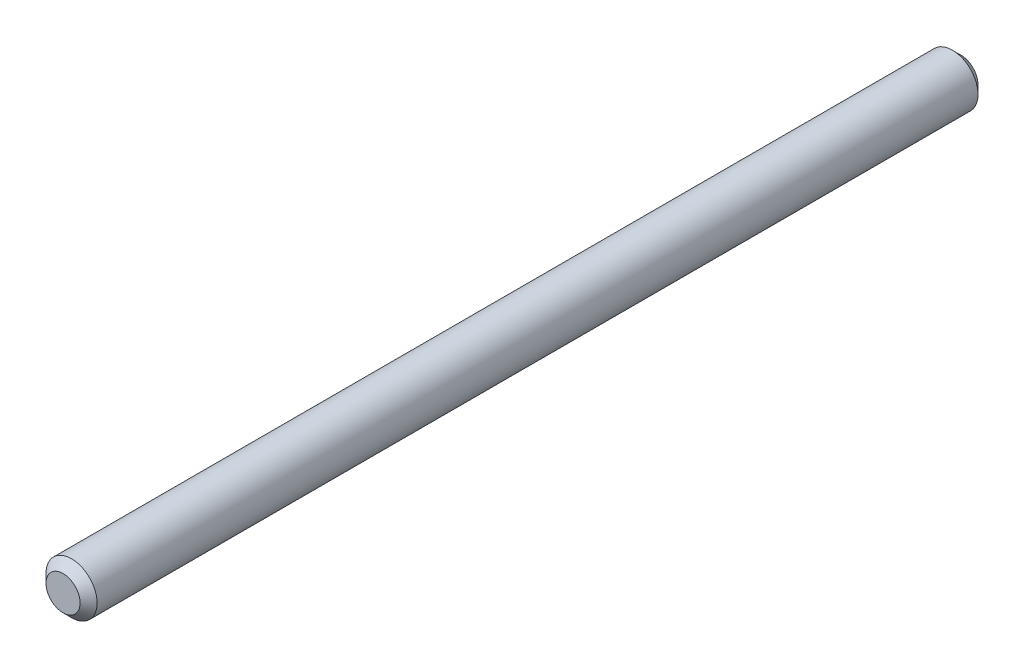
from build123d import *

# Parameters (mm, degrees)
SZKIC1_R                                = 3
DODANIE_WYCI_GNI_CIE1_DEPTH             = 40
SFAZOWANIE1_SIZE                        = 1
DODANIE_WYCI_GNI_CIE2_START             = 40
SZKIC1_2_R                              = 3
DODANIE_WYCI_GNI_CIE2_DEPTH             = 25.4
DODANIE_WYCI_GNI_CIE2_DIRECTION_2_REACH = 82.224
SFAZOWANIE2_SIZE                        = 1


with BuildPart() as part:
    # Szkic1 → Dodanie-wyciągnięcie1 (new, symmetric)
    with BuildSketch(Plane.XY):
        Circle(SZKIC1_R)
    extrude(amount=DODANIE_WYCI_GNI_CIE1_DEPTH, both=True)

    # Sfazowanie1
    sfazowanie1_edges = [part.edges().sort_by_distance(p)[0] for p in [
        (-3, 0, -40),
        (-3, 0, 40),
    ]]
    chamfer(sfazowanie1_edges, length=SFAZOWANIE1_SIZE)

    # Szkic1<2> → Dodanie-wyciągnięcie2 (add)
    with BuildSketch(Plane.XY.offset(DODANIE_WYCI_GNI_CIE2_START)):
        Circle(SZKIC1_2_R)
    extrude(amount=DODANIE_WYCI_GNI_CIE2_DEPTH)

    # Szkic1<2> → Dodanie-wyciągnięcie2 direction 2 (add, up to next)
    with BuildSketch(Plane.XY.offset(DODANIE_WYCI_GNI_CIE2_START), mode=Mode.PRIVATE) as dodanie_wyci_gni_cie2_direction_2_sk1:
        Circle(SZKIC1_2_R)
    dodanie_wyci_gni_cie2_direction_2_tool1 = extrude(dodanie_wyci_gni_cie2_direction_2_sk1.sketch, amount=-DODANIE_WYCI_GNI_CIE2_DIRECTION_2_REACH, mode=Mode.PRIVATE) - part.part
    add(dodanie_wyci_gni_cie2_direction_2_tool1.solids().sort_by_distance((0, 0, 40))[0])

    # Sfazowanie2
    sfazowanie2_edges = [part.edges().sort_by_distance(p)[0] for p in [
        (-3, 0, 65.4),
    ]]
    chamfer(sfazowanie2_edges, length=SFAZOWANIE2_SIZE)


solid = part.part
